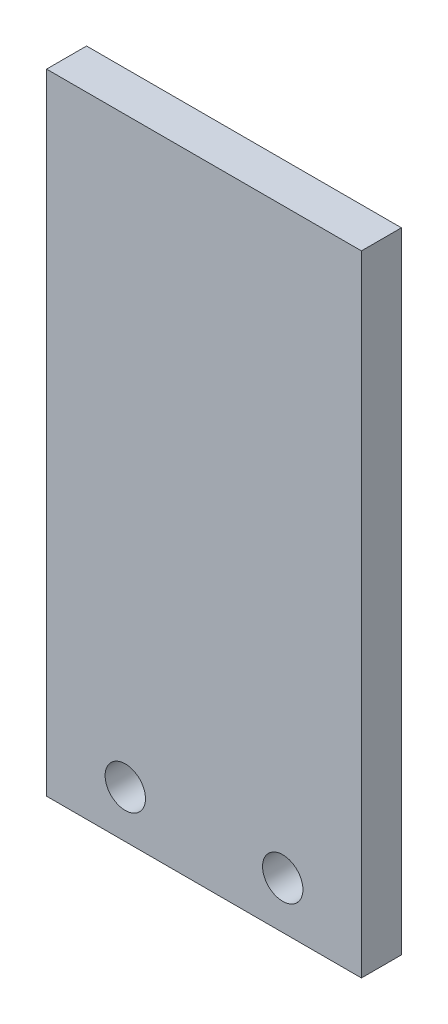
from build123d import *

# Parameters (mm, degrees)
SKETCH1_W                  = 100
SKETCH1_H                  = 200
BOSS_EXTRUDE1_DEPTH        = 12.7
F_1_2_0_5_DIAMETER_HOLE1_D = 12.827


with BuildPart() as part:
    # Sketch1 → Boss-Extrude1 (new body)
    with BuildSketch(Plane.XY):
        with Locations((50, 100)):
            Rectangle(SKETCH1_W, SKETCH1_H)
    extrude(amount=BOSS_EXTRUDE1_DEPTH)

    # 1/2 (0.5) Diameter Hole1 (through all)
    with Locations(Plane.XY.offset(12.7)):
        with Locations((75, 15), (25, 15)):
            Hole(F_1_2_0_5_DIAMETER_HOLE1_D / 2)


solid = part.part
